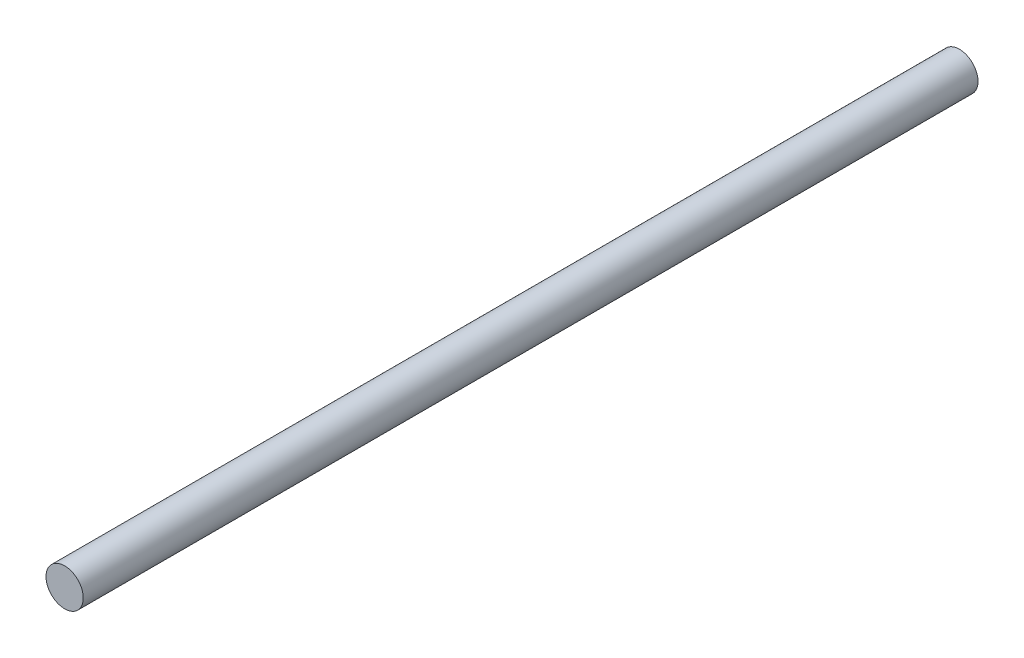
from build123d import *

# Parameters (mm, degrees)
SKETCH1_R           = 6.35
BOSS_EXTRUDE1_DEPTH = 304.8


with BuildPart() as part:
    # Sketch1 → Boss-Extrude1 (new body)
    with BuildSketch(Plane.XY):
        Circle(SKETCH1_R)
    extrude(amount=BOSS_EXTRUDE1_DEPTH)


solid = part.part
